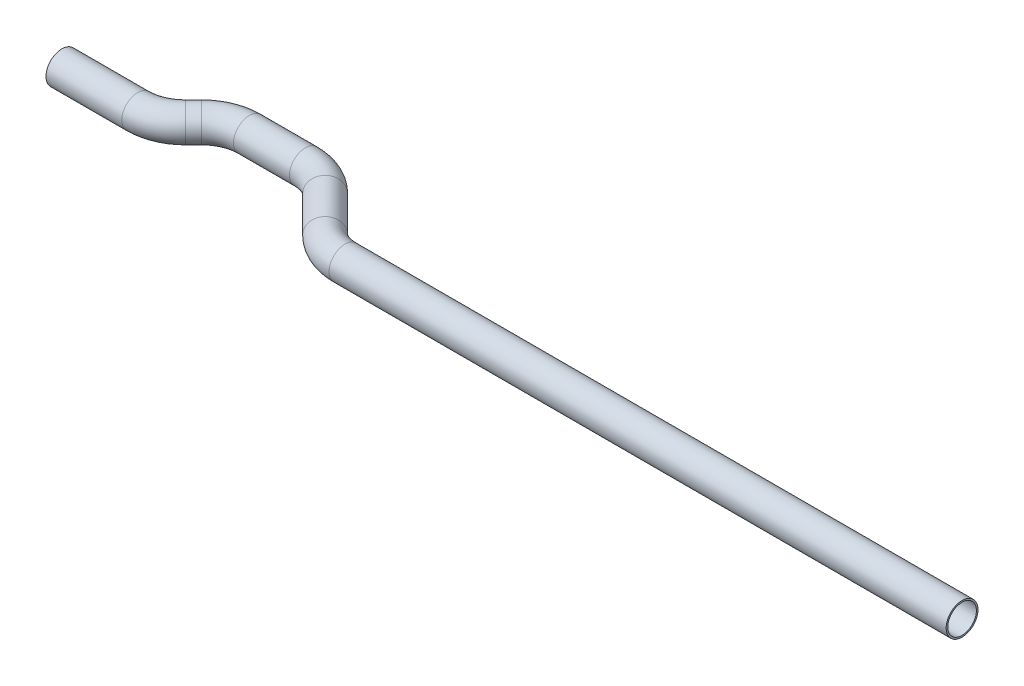
from build123d import *

# Parameters (mm, degrees)
SKETCH2_R   = 6.35
SKETCH2_R_2 = 5.715


with BuildPart() as part:
    # Sweep1: sweep along a path in Sketch1
    with BuildLine(Plane(origin=(0, 0, 0), x_dir=(1, 0, 0), z_dir=(0, 1, 0))) as sweep1_path:
        Line((0, 0), (30.209231637, 0))
        ThreePointArc((30.209231637, 0), (37.499351023, 1.450094906), (43.679615818, 5.579615818))
        Line((43.679615818, 5.579615818), (46.914242973, 8.814242973))
        ThreePointArc((46.914242973, 8.814242973), (53.094507768, 12.943763886), (60.384627155, 14.393858792))
        Line((60.384627155, 14.393858792), (82.703090428, 14.393858792))
        ThreePointArc((82.703090428, 14.393858792), (89.993209815, 12.943763886), (96.17347461, 8.814242973))
        Line((96.17347461, 8.814242973), (110.414242973, -5.42652539))
        ThreePointArc((110.414242973, -5.42652539), (116.594507768, -9.556046303), (123.884627155, -11.006141208))
        Line((123.884627155, -11.006141208), (369.993858792, -11.006141208))
    # Sketch2 → Sweep1 (sweep)
    with BuildSketch(Plane(origin=(0, 0, 0), x_dir=(0, 0, -1), z_dir=(1, 0, 0))):
        Circle(SKETCH2_R)
        Circle(SKETCH2_R_2, mode=Mode.SUBTRACT)
    sweep(path=sweep1_path.line)


solid = part.part
